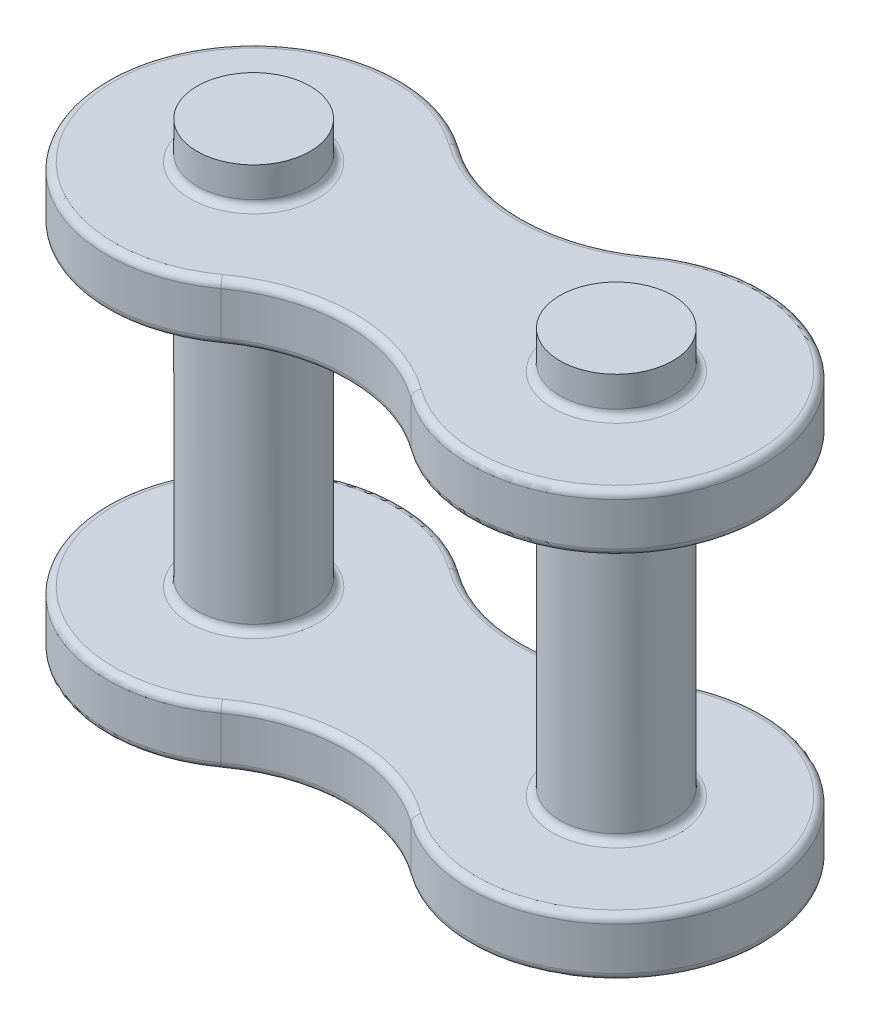
from build123d import *

# Parameters (mm, degrees)
SKETCH2_R            = 1.98
BOSS_EXTRUDE1_DEPTH  = 1.0033
SKETCH5_R            = 1.98
BOSS_EXTRUDE2_DEPTH  = 8.7503
FILLET1_R            = 0.254
FILLET1_OF_MIRROR1_R = 0.254


with BuildPart() as part:
    # Sketch2 → Boss-Extrude1 (new, symmetric)
    with BuildSketch(Plane(origin=(0, 0, 0), x_dir=(1, 0, 0), z_dir=(0, 1, 0))):
        with BuildLine():
            ThreePointArc((-3.329269201, 4.163025065), (-11.4935, 0), (-3.329269201, -4.163025065))
            ThreePointArc((-3.329269201, -4.163025065), (0, -3.082404108), (3.329269201, -4.163025065))
            ThreePointArc((3.329269201, -4.163025065), (11.4935, 0), (3.329269201, 4.163025065))
            ThreePointArc((3.329269201, 4.163025065), (0, 3.082404108), (-3.329269201, 4.163025065))
        make_face()
        with Locations((-6.35, 0)):
            Circle(SKETCH2_R, mode=Mode.SUBTRACT)
        with Locations((6.35, 0)):
            Circle(SKETCH2_R, mode=Mode.SUBTRACT)
    boss_extrude1 = extrude(amount=BOSS_EXTRUDE1_DEPTH, both=True)

    # Sketch5 → Boss-Extrude2 (add, symmetric)
    with BuildSketch(Plane(origin=(0, 6.4389, 0), x_dir=(1, 0, 0), z_dir=(0, 1, 0))):
        with Locations((-6.35, 0)):
            Circle(SKETCH5_R)
        with Locations((6.35, 0)):
            Circle(SKETCH5_R)
    extrude(amount=BOSS_EXTRUDE2_DEPTH, both=True)

    # Fillet1
    fillet1_edges = [part.edges().sort_by_distance(p)[0] for p in [
        (11.4935, -1.0033, 0),
        (0, -1.0033, 3.082404108),
        (-11.4935, -1.0033, 0),
        (0, 1.0033, -3.082404108),
        (11.4935, 1.0033, 0),
        (0, 1.0033, 3.082404108),
        (-8.33, -1.0033, 0),
        (4.37, -1.0033, 0),
        (4.37, 1.0033, 0),
        (-8.33, 1.0033, 0),
        (0, -1.0033, -3.082404108),
        (-11.4935, 1.0033, 0),
    ]]
    fillet(fillet1_edges, radius=FILLET1_R)

    # Mirror1: Boss-Extrude1 across plane
    add(boss_extrude1.mirror(Plane.ZX.offset(6.4389)))

    # Fillet1 of Mirror1
    fillet1_of_mirror1_edges = [part.edges().sort_by_distance(p)[0] for p in [
        (11.4935, 13.8811, 0),
        (0, 13.8811, 3.082404108),
        (-11.4935, 13.8811, 0),
        (0, 11.8745, -3.082404108),
        (11.4935, 11.8745, 0),
        (0, 11.8745, 3.082404108),
        (-8.33, 13.8811, 0),
        (4.37, 13.8811, 0),
        (4.37, 11.8745, 0),
        (-8.33, 11.8745, 0),
        (0, 13.8811, -3.082404108),
        (-11.4935, 11.8745, 0),
    ]]
    fillet(fillet1_of_mirror1_edges, radius=FILLET1_OF_MIRROR1_R)


solid = part.part
